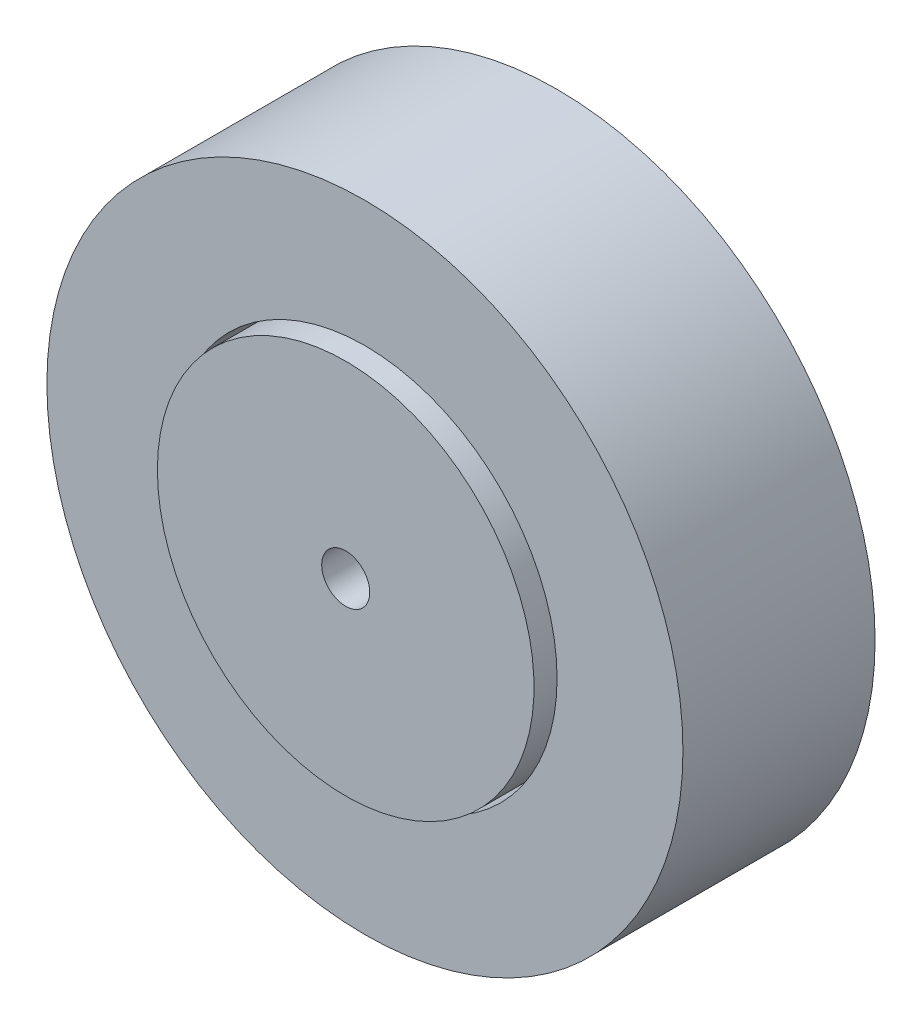
from build123d import *

# Parameters (mm, degrees)
SKETCH1_R           = 12.446
SKETCH1_R_2         = 1.5875
BOSS_EXTRUDE1_DEPTH = 7.62
SKETCH2_R           = 21.0185
SKETCH2_R_2         = 12.7
BOSS_EXTRUDE2_DEPTH = 6.35


with BuildPart() as part:
    # Sketch1 → Boss-Extrude1 (new, symmetric)
    with BuildSketch(Plane.XY):
        Circle(SKETCH1_R)
        Circle(SKETCH1_R_2, mode=Mode.SUBTRACT)
    extrude(amount=BOSS_EXTRUDE1_DEPTH, both=True)


with BuildPart() as body_2:
    # Sketch2 → Boss-Extrude2 (new, symmetric)
    with BuildSketch(Plane.XY):
        Circle(SKETCH2_R)
        Circle(SKETCH2_R_2, mode=Mode.SUBTRACT)
    extrude(amount=BOSS_EXTRUDE2_DEPTH, both=True)


solid = Compound([part.part, body_2.part])
